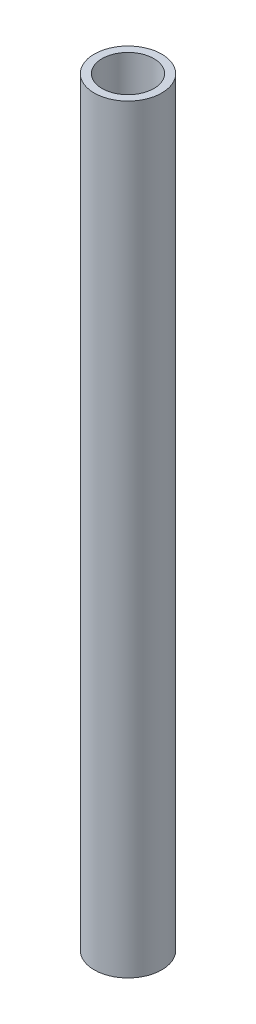
from build123d import *

# Parameters (mm, degrees)
SKETCH1_R           = 6.35
SKETCH1_R_2         = 4.8768
BOSS_EXTRUDE1_DEPTH = 142.875


with BuildPart() as part:
    # Sketch1 → Boss-Extrude1 (new body)
    with BuildSketch(Plane(origin=(0, 0, 0), x_dir=(1, 0, 0), z_dir=(0, 1, 0))):
        Circle(SKETCH1_R)
        Circle(SKETCH1_R_2, mode=Mode.SUBTRACT)
    extrude(amount=BOSS_EXTRUDE1_DEPTH)


solid = part.part
